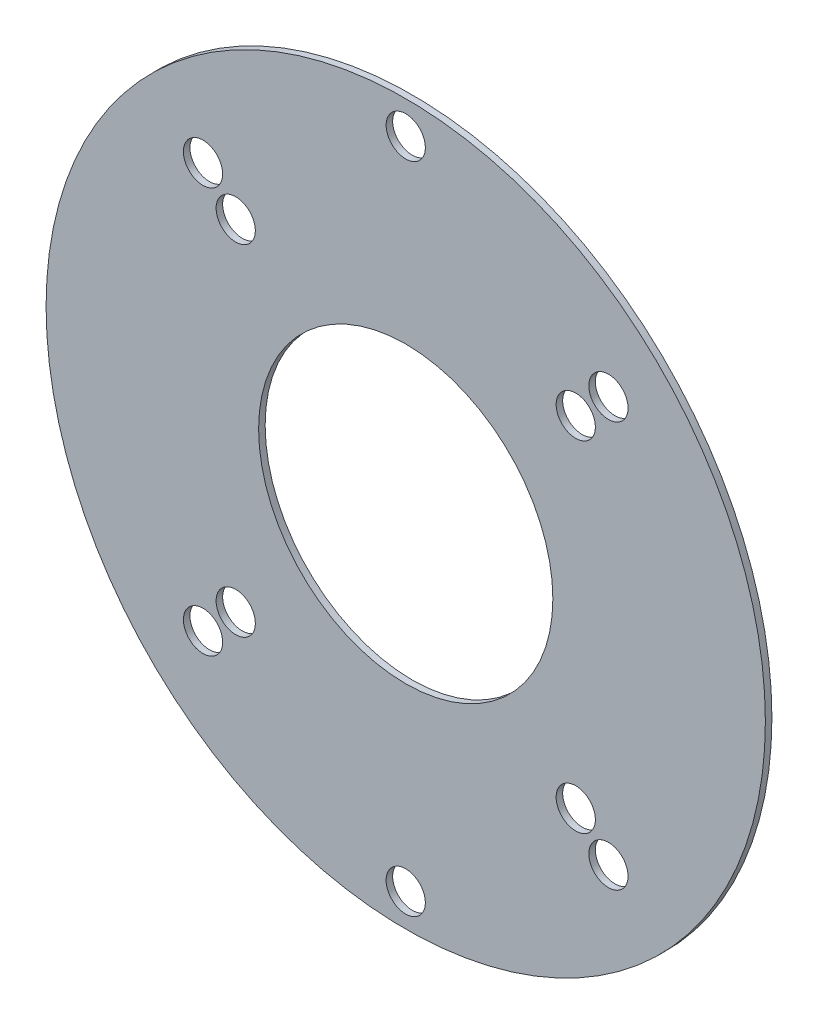
from build123d import *

# Parameters (mm, degrees)
CROQUIS1_R            = 27.5
BRIDA_BASE1_DEPTH     = 0.5
CROQUIS6_R            = 11.25
CROQUIS6_R_2          = 1.5
CORTAR_EXTRUIR3_DEPTH = 10


# Sheet-metal steps are written as plain solids
with BuildPart() as part:
    # Croquis1 → Brida base1 (new body)
    with BuildSketch(Plane.XY):
        Circle(CROQUIS1_R)
    extrude(amount=-BRIDA_BASE1_DEPTH)

    # Croquis6 → Cortar-Extruir3 (cut)
    with BuildSketch(Plane.XY):
        Circle(CROQUIS6_R)
        with Locations((-13, 13)):
            Circle(CROQUIS6_R_2)
        with Locations((-13, -13)):
            Circle(CROQUIS6_R_2)
        with Locations((13, 13)):
            Circle(CROQUIS6_R_2)
        with Locations((0, 25)):
            Circle(CROQUIS6_R_2)
        with Locations((-15.5, 15.5)):
            Circle(CROQUIS6_R_2)
        with Locations((-15.5, -15.5)):
            Circle(CROQUIS6_R_2)
        with Locations((0, -25)):
            Circle(CROQUIS6_R_2)
        with Locations((13, -13)):
            Circle(CROQUIS6_R_2)
        with Locations((15.5, -15.5)):
            Circle(CROQUIS6_R_2)
        with Locations((15.5, 15.5)):
            Circle(CROQUIS6_R_2)
    extrude(amount=-CORTAR_EXTRUIR3_DEPTH, mode=Mode.SUBTRACT)


solid = part.part
